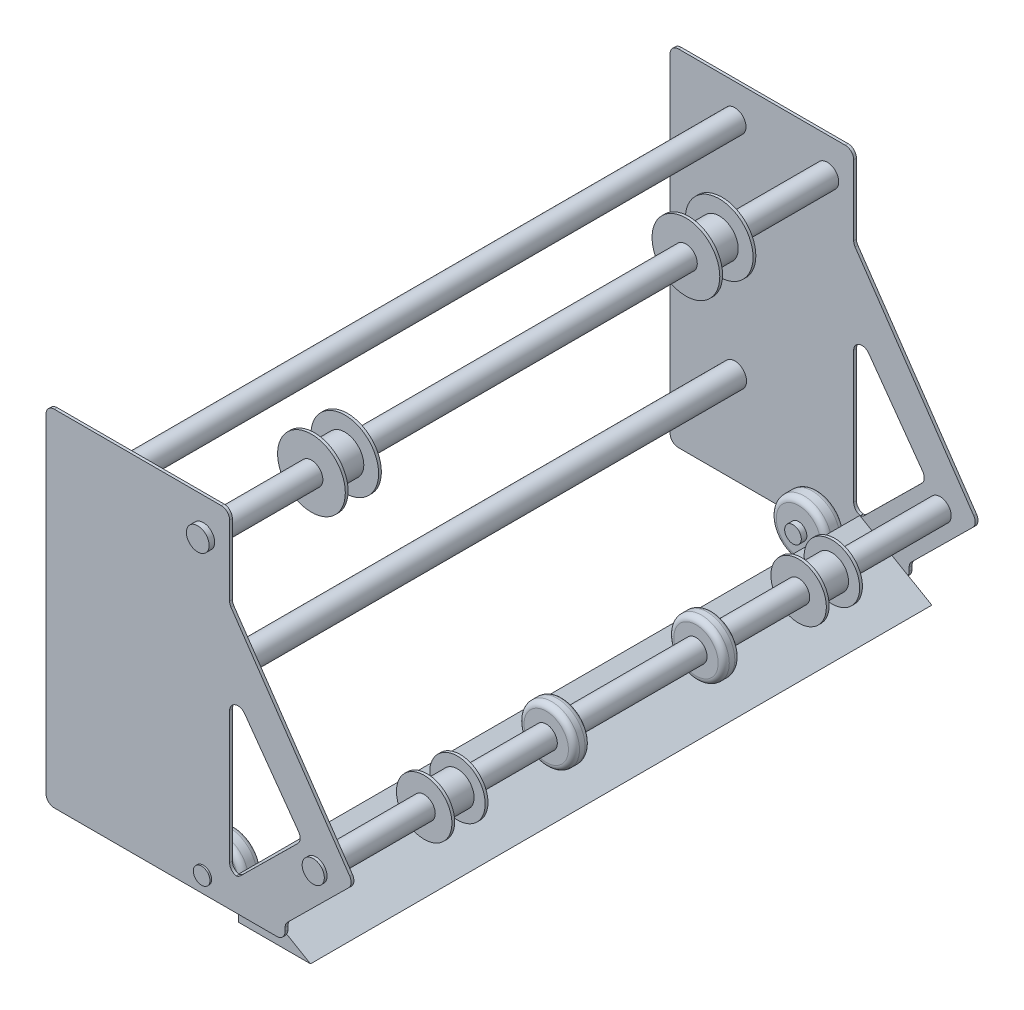
from build123d import *

# Parameters (mm, degrees)
SKETCH1_R                 = 12.7
BOSS_EXTRUDE1_DEPTH       = 8.89
FILLET1_R                 = 2.54
BOSS_EXTRUDE2_DEPTH       = 6.35
BOSS_EXTRUDE2_DEPTH_BACK  = 11.43
SKETCH2_R                 = 3.81
BOSS_EXTRUDE3_START       = -0.762
SKETCH3_W                 = 50.8
SKETCH3_H                 = 14.629272965
BOSS_EXTRUDE3_DEPTH       = 1.27
BOSS_EXTRUDE4_DEPTH       = 142.24
BOSS_EXTRUDE7_DEPTH       = 1.27
BOSS_EXTRUDE8_DEPTH       = 1.27
BOSS_EXTRUDE8_DEPTH_BACK  = 143.51
SKETCH9_R                 = 5.08
BOSS_EXTRUDE9_START       = -50.8
SKETCH10_R                = 12.7
BOSS_EXTRUDE9_DEPTH       = 1.27
SKETCH11_R                = 7.62
BOSS_EXTRUDE10_DEPTH      = 15.24
BOSS_EXTRUDE11_START      = -66.04
SKETCH10_2_R              = 12.7
BOSS_EXTRUDE11_DEPTH      = 1.27
BOSS_EXTRUDE12_START      = -106.68
SKETCH10_3_R              = 12.7
BOSS_EXTRUDE12_DEPTH      = 7.62
FILLET2_R                 = 2.54
BOSS_EXTRUDE13_DEPTH      = 1.27
BOSS_EXTRUDE14_DEPTH      = 1.27
BOSS_EXTRUDE14_DEPTH_BACK = 146.05
SKETCH13_R                = 5.207
BOSS_EXTRUDE15_START      = -49.53
SKETCH14_R                = 15.500363601
BOSS_EXTRUDE15_DEPTH      = 1.27
BOSS_EXTRUDE16_START      = -64.77
SKETCH14_2_R              = 15.500363601
BOSS_EXTRUDE16_DEPTH      = 1.27
BOSS_EXTRUDE17_START      = -50.8
SKETCH15_R                = 8.717712657
BOSS_EXTRUDE17_DEPTH      = 13.97
SKETCH16_W                = 58.664288965
SKETCH16_H                = 158.127375556
BOSS_EXTRUDE18_DEPTH      = 1.27
SKETCH17_R                = 5.114908818
SKETCH17_R_2              = 5.374499797
BOSS_EXTRUDE19_DEPTH      = 144.78
FILLET3_R                 = 3.81


with BuildPart() as part:
    # Sketch1 → Boss-Extrude1 (new body)
    with BuildSketch(Plane.XY):
        Circle(SKETCH1_R)
    extrude(amount=BOSS_EXTRUDE1_DEPTH)

    # Fillet1
    fillet1_edges = [part.edges().sort_by_distance(p)[0] for p in [
        (-12.7, 0, 0),
        (-12.7, 0, 8.89),
    ]]
    fillet(fillet1_edges, radius=FILLET1_R)

    # Sketch2 → Boss-Extrude2 (add, two sides: drawn at the far end of the back side and taken through both)
    with BuildSketch(Plane.XY.offset(8.89).offset(-BOSS_EXTRUDE2_DEPTH_BACK)):
        Circle(SKETCH2_R)
    extrude(amount=BOSS_EXTRUDE2_DEPTH + BOSS_EXTRUDE2_DEPTH_BACK)

    # Sketch3 → Boss-Extrude3 (add)
    with BuildSketch(Plane.XY.offset(15.24).offset(BOSS_EXTRUDE3_START)):
        with Locations((12.042369007, -0.313474423)):
            Rectangle(SKETCH3_W, SKETCH3_H)
    extrude(amount=-BOSS_EXTRUDE3_DEPTH)

    # Sketch4 → Boss-Extrude4 (add)
    with BuildSketch(Plane(origin=(0, 0, 13.208), x_dir=(-1, 0, 0), z_dir=(0, 0, -1))):
        Polygon((-14.835364567, 7.00116206), (-14.835364567, -12.04883794), (-47.830932451, -12.04883794), align=None)
    extrude(amount=BOSS_EXTRUDE4_DEPTH)

    # Sketch8 → Boss-Extrude7 (add)
    with BuildSketch(Plane.XY.offset(14.478)):
        Polygon((15.921084948, 7.00116206), (30.372203795, -7.628110905), (68.825986779, 30.357384979), (54.374867932, 44.986657944), align=None)
    extrude(amount=-BOSS_EXTRUDE7_DEPTH)

    # Sketch9 → Boss-Extrude8 (add, two sides: drawn at the far end of the back side and taken through both)
    with BuildSketch(Plane.XY.offset(14.478).offset(-BOSS_EXTRUDE8_DEPTH_BACK)):
        with Locations((51.603755759, 27.789588183)):
            Circle(SKETCH9_R)
    extrude(amount=BOSS_EXTRUDE8_DEPTH + BOSS_EXTRUDE8_DEPTH_BACK)

    # Sketch10 → Boss-Extrude9 (add)
    with BuildSketch(Plane.XY.offset(15.748).offset(BOSS_EXTRUDE9_START)):
        with Locations((51.603755759, 27.789588183)):
            Circle(SKETCH10_R)
    extrude(amount=-BOSS_EXTRUDE9_DEPTH)

    # Sketch11 → Boss-Extrude10 (add)
    with BuildSketch(Plane.XY.offset(-35.052)):
        with Locations((51.603755759, 27.789588183)):
            Circle(SKETCH11_R)
    extrude(amount=-BOSS_EXTRUDE10_DEPTH)

    # Sketch10<2> → Boss-Extrude11 (add)
    with BuildSketch(Plane.XY.offset(15.748).offset(BOSS_EXTRUDE11_START)):
        with Locations((51.603755759, 27.789588183)):
            Circle(SKETCH10_2_R)
    extrude(amount=-BOSS_EXTRUDE11_DEPTH)

    # Sketch10<3> → Boss-Extrude12 (add)
    with BuildSketch(Plane.XY.offset(15.748).offset(BOSS_EXTRUDE12_START)):
        with Locations((51.603755759, 27.789588183)):
            Circle(SKETCH10_3_R)
    extrude(amount=-BOSS_EXTRUDE12_DEPTH)

    # Fillet2
    fillet2_edges = [part.edges().sort_by_distance(p)[0] for p in [
        (38.903755759, 27.789588183, -98.552),
        (38.903755759, 27.789588183, -90.932),
    ]]
    fillet(fillet2_edges, radius=FILLET2_R)

    # Sketch12 → Boss-Extrude13 (add)
    with BuildSketch(Plane.XY.offset(14.478)):
        Polygon((12.042369007, 82.966832593), (12.042369007, 113.367731307), (-13.357630993, 150.499264651), (-13.357630993, 118.392840705), align=None)
        Polygon((-13.357630993, 150.499264651), (12.042369007, 113.367731307), (12.042369007, 150.499264651), align=None)
        Polygon((54.374867932, 44.986657944), (68.825986779, 30.357384979), (12.042369007, 113.367731307), (12.042369007, 82.966832593), (45.534744263, 36.254188595), align=None)
        Polygon((12.042369007, 7.00116206), (12.042369007, 82.966832593), (-13.357630993, 118.392840705), (-13.357630993, 7.00116206), align=None)
    extrude(amount=-BOSS_EXTRUDE13_DEPTH)

    # Sketch13 → Boss-Extrude14 (add, two sides: drawn at the far end of the back side and taken through both)
    with BuildSketch(Plane.XY.offset(15.748).offset(-BOSS_EXTRUDE14_DEPTH_BACK)):
        with Locations((0, 134.450162752)):
            Circle(SKETCH13_R)
    extrude(amount=BOSS_EXTRUDE14_DEPTH + BOSS_EXTRUDE14_DEPTH_BACK)

    # Sketch14 → Boss-Extrude15 (add)
    with BuildSketch(Plane.XY.offset(14.478).offset(BOSS_EXTRUDE15_START)):
        with Locations((0, 134.450162752)):
            Circle(SKETCH14_R)
    extrude(amount=-BOSS_EXTRUDE15_DEPTH)

    # Sketch14<2> → Boss-Extrude16 (add)
    with BuildSketch(Plane.XY.offset(14.478).offset(BOSS_EXTRUDE16_START)):
        with Locations((0, 134.450162752)):
            Circle(SKETCH14_2_R)
    extrude(amount=-BOSS_EXTRUDE16_DEPTH)

    # Sketch15 → Boss-Extrude17 (add)
    with BuildSketch(Plane.XY.offset(14.478).offset(BOSS_EXTRUDE17_START)):
        with Locations((0, 134.450162752)):
            Circle(SKETCH15_R)
    extrude(amount=-BOSS_EXTRUDE17_DEPTH)

    # Sketch16 → Boss-Extrude18 (add)
    with BuildSketch(Plane.XY.offset(14.478)):
        with Locations((-42.689775475, 71.435576873)):
            Rectangle(SKETCH16_W, SKETCH16_H)
    extrude(amount=-BOSS_EXTRUDE18_DEPTH)

    # Sketch17 → Boss-Extrude19 (add)
    with BuildSketch(Plane.XY.offset(14.478)):
        with Locations((-42.370972788, 134.997033795)):
            Circle(SKETCH17_R)
        with Locations((-42.370972788, 34.303521842)):
            Circle(SKETCH17_R_2)
    extrude(amount=-BOSS_EXTRUDE19_DEPTH)

    # Mirror1: part across plane


with BuildPart() as part_1:
    add(part.part)
    add(part.part.mirror(Plane(origin=(51.603755759, 27.789588183, -129.032), x_dir=(1, 0, 0), z_dir=(0, 0, 1))))

    # Fillet3
    # the kernel refuses this fillet: 3.81 mm, written as the material it adds along each edge
    with BuildSketch(Plane(origin=(12.042369007, 113.367731307, 14.478), x_dir=(0.5645963108127381, -0.8253671945362537, 0), z_dir=(0, 0, -1))) as fillet3_piece_1:
        with BuildLine():
            CenterArc((FILLET3_R * 0.309305608484, -FILLET3_R), FILLET3_R, 90, 34.374263108)
            Line((-FILLET3_R * 0.255290702329, -FILLET3_R * 0.174632805464), (0, 0))
            Line((0, 0), (FILLET3_R * 0.309305608484, 0))
        make_face()
    extrude(amount=1.27)
    with BuildSketch(Plane(origin=(45.534744263, 36.254188595, 14.478), x_dir=(-0.5826911157324867, 0.8126937083836874, 0), z_dir=(0, 0, -1))) as fillet3_piece_2:
        with BuildLine():
            CenterArc((FILLET3_R * 0.853945609754, -FILLET3_R), FILLET3_R, 90, 80.991049447)
            Line((-FILLET3_R * 0.133718281125, -FILLET3_R * 0.843411243529), (0, 0))
            Line((0, 0), (FILLET3_R * 0.853945609754, 0))
        make_face()
    extrude(amount=1.27)
    with BuildSketch(Plane(origin=(12.042369007, 82.966832593, 14.478), x_dir=(0, -1, 0), z_dir=(0, 0, -1))) as fillet3_piece_3:
        with BuildLine():
            CenterArc((FILLET3_R * 3.11089985662, -FILLET3_R), FILLET3_R, 90, 144.359955157)
            Line((FILLET3_R * 2.52820874088, -FILLET3_R * 1.81269370838), (0, 0))
            Line((0, 0), (FILLET3_R * 3.11089985662, 0))
        make_face()
    extrude(amount=1.27)
    with BuildSketch(Plane(origin=(12.042369007, 7.00116206, 14.478), x_dir=(0, 1, 0), z_dir=(0, 0, -1))) as fillet3_piece_4:
        with BuildLine():
            CenterArc((FILLET3_R, FILLET3_R), FILLET3_R, 180, 90)
            Line((0, FILLET3_R), (0, 0))
            Line((0, 0), (FILLET3_R, 0))
        make_face()
    extrude(amount=1.27)
    with BuildSketch(Plane(origin=(15.921084948, 7.00116206, -272.542), x_dir=(0.71142535289609, 0.7027616717327957, 0), z_dir=(0, 0, 1))) as fillet3_piece_5:
        with BuildLine():
            CenterArc((FILLET3_R * 0.410629461895, FILLET3_R), FILLET3_R, 225.351004603, 44.648995397)
            Line((-FILLET3_R * 0.292132209838, FILLET3_R * 0.288574647104), (0, 0))
            Line((0, 0), (FILLET3_R * 0.410629461895, 0))
        make_face()
    extrude(amount=1.27)
    with BuildSketch(Plane(origin=(37.442369007, -0.6440456, -272.542), x_dir=(0, -1, 0), z_dir=(0, 0, 1))) as fillet3_piece_6:
        with BuildLine():
            CenterArc((FILLET3_R * 0.417806769266, FILLET3_R), FILLET3_R, 224.648995397, 45.351004603)
            Line((-FILLET3_R * 0.29361858363, FILLET3_R * 0.297238328267), (0, 0))
            Line((0, 0), (FILLET3_R * 0.417806769266, 0))
        make_face()
    extrude(amount=1.27)
    with BuildSketch(Plane(origin=(45.534744263, 36.254188595, -272.542), x_dir=(-0.5826911157324867, 0.8126937083836874, 0), z_dir=(0, 0, 1))) as fillet3_piece_7:
        with BuildLine():
            CenterArc((FILLET3_R * 0.853945609754, FILLET3_R), FILLET3_R, 189.008950553, 80.991049447)
            Line((-FILLET3_R * 0.133718281125, FILLET3_R * 0.843411243529), (0, 0))
            Line((0, 0), (FILLET3_R * 0.853945609754, 0))
        make_face()
    extrude(amount=1.27)
    with BuildSketch(Plane(origin=(12.042369007, 113.367731307, -272.542), x_dir=(0.5645963108127381, -0.8253671945362537, 0), z_dir=(0, 0, 1))) as fillet3_piece_8:
        with BuildLine():
            CenterArc((FILLET3_R * 0.309305608484, FILLET3_R), FILLET3_R, 235.625736892, 34.374263108)
            Line((-FILLET3_R * 0.255290702329, FILLET3_R * 0.174632805464), (0, 0))
            Line((0, 0), (FILLET3_R * 0.309305608484, 0))
        make_face()
    extrude(amount=1.27)
    with BuildSketch(Plane(origin=(12.042369007, 82.966832593, -272.542), x_dir=(0, -1, 0), z_dir=(0, 0, 1))) as fillet3_piece_9:
        with BuildLine():
            CenterArc((FILLET3_R * 3.11089985662, FILLET3_R), FILLET3_R, 125.640044843, 144.359955157)
            Line((FILLET3_R * 2.52820874088, FILLET3_R * 1.81269370838), (0, 0))
            Line((0, 0), (FILLET3_R * 3.11089985662, 0))
        make_face()
    extrude(amount=1.27)
    with BuildSketch(Plane(origin=(12.042369007, 7.00116206, -272.542), x_dir=(0, 1, 0), z_dir=(0, 0, 1))) as fillet3_piece_10:
        with BuildLine():
            CenterArc((FILLET3_R, -FILLET3_R), FILLET3_R, 90, 90)
            Line((0, -FILLET3_R), (0, 0))
            Line((0, 0), (FILLET3_R, 0))
        make_face()
    extrude(amount=1.27)
    with BuildSketch(Plane(origin=(15.921084948, 7.00116206, 14.478), x_dir=(0.71142535289609, 0.7027616717327957, 0), z_dir=(0, 0, -1))) as fillet3_piece_11:
        with BuildLine():
            CenterArc((FILLET3_R * 0.410629461895, -FILLET3_R), FILLET3_R, 90, 44.648995397)
            Line((-FILLET3_R * 0.292132209838, -FILLET3_R * 0.288574647104), (0, 0))
            Line((0, 0), (FILLET3_R * 0.410629461895, 0))
        make_face()
    extrude(amount=1.27)
    with BuildSketch(Plane(origin=(37.442369007, -0.6440456, 14.478), x_dir=(0, -1, 0), z_dir=(0, 0, -1))) as fillet3_piece_12:
        with BuildLine():
            CenterArc((FILLET3_R * 0.417806769266, -FILLET3_R), FILLET3_R, 90, 45.351004603)
            Line((-FILLET3_R * 0.29361858363, -FILLET3_R * 0.297238328267), (0, 0))
            Line((0, 0), (FILLET3_R * 0.417806769266, 0))
        make_face()
    extrude(amount=1.27)
    # the kernel refuses this fillet: 3.81 mm, written as the material it takes off along each edge
    with BuildSketch(Plane(origin=(12.042369007, 150.499264651, 24.003), x_dir=(-1, 0, 0), z_dir=(0, 0, -1)), Plane(origin=(-72.021919958, -7.628110905, 24.003), x_dir=(1, 0, 0), z_dir=(0, 0, -1)), Plane(origin=(-72.021919958, 150.499264651, 24.003), x_dir=(0, -1, 0), z_dir=(0, 0, -1))) as fillet3_2_piece_1:
        with BuildLine():
            CenterArc((FILLET3_R, -FILLET3_R), FILLET3_R, 90, 90)
            Line((0, -FILLET3_R), (0, 0))
            Line((0, 0), (FILLET3_R, 0))
        make_face()
    extrude(amount=20.32, mode=Mode.SUBTRACT)
    with BuildSketch(Plane(origin=(37.442369007, -7.628110905, 24.003), x_dir=(-1, 0, 0), z_dir=(0, 0, -1))) as fillet3_2_piece_2:
        with BuildLine():
            CenterArc((FILLET3_R, FILLET3_R), FILLET3_R, 180, 90)
            Line((0, FILLET3_R), (0, 0))
            Line((0, 0), (FILLET3_R, 0))
        make_face()
    extrude(amount=10.795, mode=Mode.SUBTRACT)
    with BuildSketch(Plane(origin=(37.442369007, -7.628110905, -282.067), x_dir=(-1, 0, 0), z_dir=(0, 0, 1))) as fillet3_2_piece_3:
        with BuildLine():
            CenterArc((FILLET3_R, -FILLET3_R), FILLET3_R, 90, 90)
            Line((0, -FILLET3_R), (0, 0))
            Line((0, 0), (FILLET3_R, 0))
        make_face()
    extrude(amount=10.795, mode=Mode.SUBTRACT)
    with BuildSketch(Plane(origin=(-72.021919958, -7.628110905, -282.067), x_dir=(1, 0, 0), z_dir=(0, 0, 1)), Plane(origin=(12.042369007, 150.499264651, -282.067), x_dir=(-1, 0, 0), z_dir=(0, 0, 1)), Plane(origin=(-72.021919958, 150.499264651, -282.067), x_dir=(0, -1, 0), z_dir=(0, 0, 1))) as fillet3_2_piece_4:
        with BuildLine():
            CenterArc((FILLET3_R, FILLET3_R), FILLET3_R, 180, 90)
            Line((0, FILLET3_R), (0, 0))
            Line((0, 0), (FILLET3_R, 0))
        make_face()
    extrude(amount=20.32, mode=Mode.SUBTRACT)
    with BuildSketch(Plane(origin=(68.825986779, 30.357384979, -280.495587302), x_dir=(-0.5645963108127314, 0.8253671945362582, 0), z_dir=(0, 0, 1))) as fillet3_2_piece_5:
        with BuildLine():
            CenterArc((FILLET3_R * 0.835022288941, FILLET3_R), FILLET3_R, 190.274732289, 79.725267711)
            Line((-FILLET3_R * 0.148941505942, FILLET3_R * 0.821631700238), (0, 0))
            Line((0, 0), (FILLET3_R * 0.835022288941, 0))
        make_face()
    extrude(amount=17.177174604, mode=Mode.SUBTRACT)
    with BuildSketch(Plane(origin=(68.825986779, 30.357384979, 22.431587302), x_dir=(-0.5645963108127314, 0.8253671945362582, 0), z_dir=(0, 0, -1))) as fillet3_2_piece_6:
        with BuildLine():
            CenterArc((FILLET3_R * 0.835022288941, -FILLET3_R), FILLET3_R, 90, 79.725267711)
            Line((-FILLET3_R * 0.148941505942, -FILLET3_R * 0.821631700238), (0, 0))
            Line((0, 0), (FILLET3_R * 0.835022288941, 0))
        make_face()
    extrude(amount=17.177174604, mode=Mode.SUBTRACT)


solid = part_1.part
